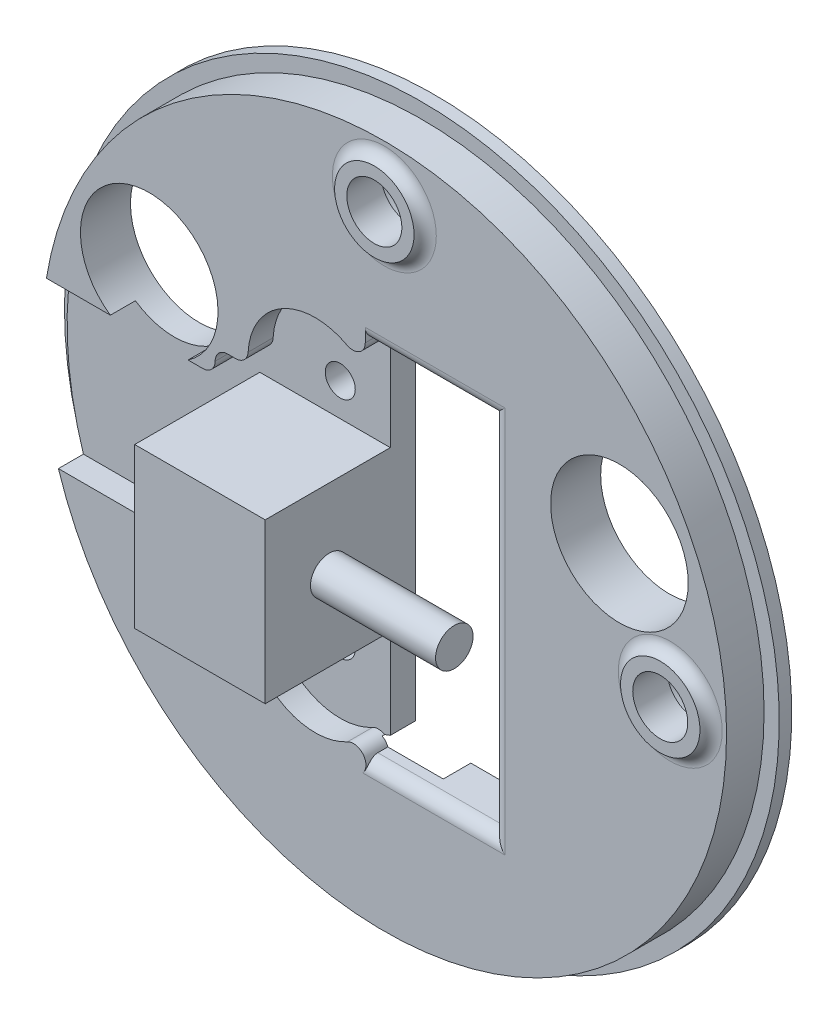
from build123d import *

# Parameters (mm, degrees)
BOSS_EXTRUDE1_START                              = -2
BOSS_EXTRUDE1_OUTLINE_R                          = 27.3625
BOSS_EXTRUDE1_DEPTH                              = 2
BOSS_EXTRUDE1_2_DEPTH                            = 0.2
BOSS_EXTRUDE1_3_OUTLINE_R                        = 28.575
BOSS_EXTRUDE1_3_OUTLINE_R_2                      = 27.3625
BOSS_EXTRUDE1_3_DEPTH                            = 1
SKETCH2_W                                        = 2.2
SKETCH2_H                                        = 28.956
CUT_EXTRUDE1_DEPTH                               = 5.723285802
BOSS_EXTRUDE2_DEPTH                              = 1.8
CUT_EXTRUDE2_START                               = -2
CUT_EXTRUDE2_DEPTH                               = 2
CUT_EXTRUDE3_START                               = -2
CUT_EXTRUDE3_DEPTH                               = 2
SKETCH6_W                                        = 5
SKETCH6_H                                        = 2.2
F_11_0_11_DIAMETER_HOLE1_D                       = 11
F_11_0_11_DIAMETER_HOLE2_D                       = 11
F_11_0_11_DIAMETER_HOLE2_DEPTH                   = 4.8
F_2_4_2_4_DIAMETER_HOLE1_D                       = 2.4
CBORE_FOR_M4_HEX_HEAD_MACHINE_SCREW1_D           = 4.4
CBORE_FOR_M4_HEX_HEAD_MACHINE_SCREW1_CBORE_D     = 7.62
CBORE_FOR_M4_HEX_HEAD_MACHINE_SCREW1_CBORE_DEPTH = 2.032
FILLET1_R                                        = 1
SKETCH17_W                                       = 10.432207601
SKETCH17_H                                       = 12.73580757
BOSS_EXTRUDE3_DEPTH                              = 10
SKETCH18_R                                       = 1.5
BOSS_EXTRUDE4_DEPTH                              = 10


with BuildPart() as part:
    # Boss-Extrude1: read off the stored shape, not the designer's step
    # Boss-Extrude1 outline → Boss-Extrude1 (new body)
    with BuildSketch(Plane.XY.offset(2).offset(BOSS_EXTRUDE1_START)):
        Circle(BOSS_EXTRUDE1_OUTLINE_R)
        with BuildLine():
            Line((-1.524, -15.557918103), (-1.524, 12.7))
            Line((-1.524, 12.7), (2.912714198, 12.7))
            Line((2.912714198, 12.7), (2.912714198, -16.256))
            ThreePointArc((2.912714198, -16.256), (0.777149513, -15.38076538), (-1.524, -15.557918103))
        make_face(mode=Mode.SUBTRACT)
    extrude(amount=BOSS_EXTRUDE1_DEPTH)

    # Boss-Extrude1 2 outline → Boss-Extrude1 2 (add)
    with BuildSketch(Plane.XY.offset(2)):
        with BuildLine():
            ThreePointArc((2.912714198, -16.256), (0.541695497, -15.349430014), (-1.968941943, -15.723994384))
            ThreePointArc((-1.968941943, -15.723994384), (-2.456104545, -15.591784186), (-2.945777915, -15.714368556))
            ThreePointArc((-2.945777915, -15.714368556), (-9.352442215, -14.770348817), (-10.198398357, -8.35))
            Line((-10.198398357, -8.35), (-26.057319629, -8.35))
            ThreePointArc((-26.057319629, -8.35), (27.285112269, 2.056466564), (-27.014512882, 4.35))
            Line((-27.014512882, 4.35), (-10.198398357, 4.35))
            ThreePointArc((-10.198398357, 4.35), (-9.371903961, 10.750484649), (-2.994712748, 11.740802252))
            ThreePointArc((-2.994712748, 11.740802252), (-2.00956475, 11.765559549), (-1.524, 12.623088776))
            Line((-1.524, 12.623088776), (-1.524, 12.7))
            Line((-1.524, 12.7), (2.912714198, 12.7))
            Line((2.912714198, 12.7), (2.912714198, -16.256))
        make_face()
    extrude(amount=BOSS_EXTRUDE1_2_DEPTH)

    # Boss-Extrude1 3 outline → Boss-Extrude1 3 (add)
    with BuildSketch(Plane.XY.offset(2).offset(BOSS_EXTRUDE1_START)):
        Circle(BOSS_EXTRUDE1_3_OUTLINE_R)
        Circle(BOSS_EXTRUDE1_3_OUTLINE_R_2, mode=Mode.SUBTRACT)
    extrude(amount=BOSS_EXTRUDE1_3_DEPTH)

    # Sketch2 → Cut-Extrude1 (cut)
    with BuildSketch(Plane.ZY.offset(-2.912714198)):
        with Locations((1.1, -1.778)):
            Rectangle(SKETCH2_W, SKETCH2_H)
    extrude(amount=-CUT_EXTRUDE1_DEPTH, mode=Mode.SUBTRACT)

    # Sketch3 → Boss-Extrude2 (add)
    with BuildSketch(Plane.XY.offset(2.2)):
        with BuildLine():
            Line((-10.198398357, 4.35), (-27.014512882, 4.35))
            ThreePointArc((-27.014512882, 4.35), (27.285112269, 2.056466564), (-26.057319629, -8.35))
            Line((-26.057319629, -8.35), (-10.198398357, -8.35))
            ThreePointArc((-10.198398357, -8.35), (-9.352442215, -14.770348817), (-2.945777915, -15.714368556))
            ThreePointArc((-2.945777915, -15.714368556), (-2.109961399, -15.657248447), (-1.524001902, -16.256))
            Line((-1.524001902, -16.256), (8.636, -16.256))
            Line((8.636, -16.256), (8.636, 12.7))
            Line((8.636, 12.7), (-1.524, 12.7))
            Line((-1.524, 12.7), (-1.524, 12.623088776))
            ThreePointArc((-1.524, 12.623088776), (-2.00956475, 11.765559549), (-2.994712748, 11.740802252))
            ThreePointArc((-2.994712748, 11.740802252), (-9.371903961, 10.750484649), (-10.198398357, 4.35))
        make_face()
    extrude(amount=BOSS_EXTRUDE2_DEPTH)

    # Sketch4 → Cut-Extrude2 (cut)
    with BuildSketch(Plane.XY.offset(4).offset(CUT_EXTRUDE2_START)):
        with BuildLine():
            Line((-14.524, 4.35), (-10.198398357, 4.35))
            ThreePointArc((-10.198398357, 4.35), (-10.627065698, 5.317376904), (-10.857854141, 6.35))
            Line((-10.857854141, 6.35), (-12.524, 6.35))
            ThreePointArc((-12.524, 6.35), (-13.231106781, 6.057106781), (-13.524, 5.35))
            ThreePointArc((-13.524, 5.35), (-13.816893219, 4.642893219), (-14.524, 4.35))
        make_face()
    extrude(amount=CUT_EXTRUDE2_DEPTH, mode=Mode.SUBTRACT)

    # Sketch5 → Cut-Extrude3 (cut)
    with BuildSketch(Plane.XY.offset(4).offset(CUT_EXTRUDE3_START)):
        with BuildLine():
            Line((-12.524, -10.35), (-10.857854141, -10.35))
            ThreePointArc((-10.857854141, -10.35), (-10.627065698, -9.317376904), (-10.198398357, -8.35))
            Line((-10.198398357, -8.35), (-14.524, -8.35))
            ThreePointArc((-14.524, -8.35), (-13.816893219, -8.642893219), (-13.524, -9.35))
            ThreePointArc((-13.524, -9.35), (-13.231106781, -10.057106781), (-12.524, -10.35))
        make_face()
    extrude(amount=CUT_EXTRUDE3_DEPTH, mode=Mode.SUBTRACT)

    # Sketch6 → Cut-Revolve1 (revolve, cut)
    with BuildSketch(Plane.XZ.offset(20.32)):
        with Locations((2.5, 1.1)):
            Rectangle(SKETCH6_W, SKETCH6_H)
    revolve(axis=Axis((0, -20.32, 2.2), (0, 0, -1)), mode=Mode.SUBTRACT)

    # Sketch7 → Revolve1 (revolve)
    with BuildSketch(Plane(origin=(0, 22.86, 0), x_dir=(1, 0, 0), z_dir=(0, 1, 0))):
        with BuildLine():
            Line((4.154795897, -4), (0, -4))
            Line((0, -4), (0, -4.8))
            Line((0, -4.8), (3.175, -4.8))
            ThreePointArc((3.175, -4.8), (3.522340365, -4.225403331), (4.154795897, -4))
        make_face()
    revolve(axis=Axis((0, 22.86, 4), (0, 0, 1)))

    # Sketch8 → Revolve2 (revolve)
    with BuildSketch(Plane(origin=(0, 0, 0), x_dir=(1, 0, 0), z_dir=(0, 1, 0))):
        with BuildLine():
            Line((27.014795897, -4), (22.86, -4))
            Line((22.86, -4), (22.86, -4.8))
            Line((22.86, -4.8), (26.035, -4.8))
            ThreePointArc((26.035, -4.8), (26.382340365, -4.225403331), (27.014795897, -4))
        make_face()
    revolve(axis=Axis((22.86, 0, 4), (0, 0, 1)))

    # Ø11.0 (11) Diameter Hole1 (through all)
    with Locations(Plane.XY.offset(4)):
        with Locations((18.796, 8.89)):
            Hole(F_11_0_11_DIAMETER_HOLE1_D / 2)

    # Ø11.0 (11) Diameter Hole2
    with Locations(Plane(origin=(0, 0, 0), x_dir=(-1, 0, 0), z_dir=(0, 0, -1))):
        with Locations((18.796, 8.89)):
            Hole(F_11_0_11_DIAMETER_HOLE2_D / 2, depth=F_11_0_11_DIAMETER_HOLE2_DEPTH)

    # Ø2.4 (2.4) Diameter Hole1 (through all)
    with Locations(Plane.XY.offset(2)):
        with Locations((-5.524, 7), (-5.524, -11)):
            Hole(F_2_4_2_4_DIAMETER_HOLE1_D / 2)

    # CBORE for M4 Hex Head Machine Screw1 (through all)
    with Locations(Plane(origin=(0, 0, 0), x_dir=(-1, 0, 0), z_dir=(0, 0, -1))):
        with Locations((-22.86, 0), (0, 22.86)):
            CounterBoreHole(CBORE_FOR_M4_HEX_HEAD_MACHINE_SCREW1_D / 2, CBORE_FOR_M4_HEX_HEAD_MACHINE_SCREW1_CBORE_D / 2, CBORE_FOR_M4_HEX_HEAD_MACHINE_SCREW1_CBORE_DEPTH)

    # Fillet1
    fillet1_edges = [part.edges().sort_by_distance(p)[0] for p in [
        (3.556, 12.7, 4),
        (8.636, -1.778, 4),
        (3.555999049, -16.256, 4),
        (-10.857854141, -10.35, 3.1),
        (-10.857854141, 6.35, 3.1),
    ]]
    fillet(fillet1_edges, radius=FILLET1_R)

    # Sketch17 → Boss-Extrude3 (add)
    with BuildSketch(Plane.XY.offset(2)):
        with Locations((-6.740103801, -2)):
            Rectangle(SKETCH17_W, SKETCH17_H)
    extrude(amount=BOSS_EXTRUDE3_DEPTH)

    # Sketch18 → Boss-Extrude4 (add)
    with BuildSketch(Plane(origin=(-1.524, 0, 0), x_dir=(0, 0, -1), z_dir=(1, 0, 0))):
        with Locations(Location((-6.880774337, -2.000001215, 0), (0, 0, 90))):
            Circle(SKETCH18_R)
    extrude(amount=BOSS_EXTRUDE4_DEPTH)


solid = part.part
